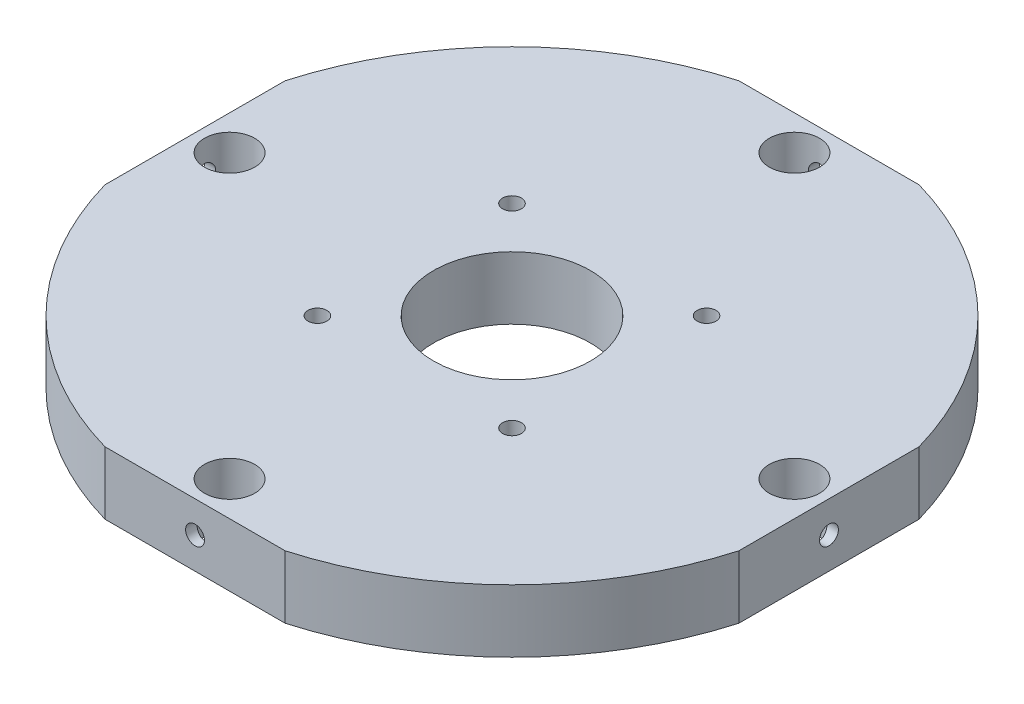
from build123d import *

# Parameters (mm, degrees)
SKETCH1_R               = 52.5
BOSS_EXTRUDE1_DEPTH     = 10
SKETCH3_R               = 4
CUT_EXTRUDE1_DEPTH      = 75.916620319
SKETCH4_W               = 28.705400188
SKETCH4_H               = 10
SKETCH4_W_2             = 10
SKETCH4_H_2             = 28.705400188
CUT_EXTRUDE_THIN1_DEPTH = 75.916620319
CUT_EXTRUDE3_REACH      = 115.363
SKETCH5_R               = 1.5
CIRPATTERN1_COUNT       = 4
SKETCH6_R               = 12.5
CUT_EXTRUDE4_DEPTH      = 73.114492456
SKETCH7_R               = 1.5
CUT_EXTRUDE5_DEPTH      = 73.114492456


with BuildPart() as part:
    # Sketch1 → Boss-Extrude1 (new body)
    with BuildSketch(Plane(origin=(0, 0, 0), x_dir=(1, 0, 0), z_dir=(0, 1, 0))):
        Circle(SKETCH1_R)
    extrude(amount=BOSS_EXTRUDE1_DEPTH)

    # Sketch3 → Cut-Extrude1 (cut, through all)
    with BuildSketch(Plane(origin=(0, 10, 0), x_dir=(1, 0, 0), z_dir=(0, 1, 0))):
        with Locations((0, 45)):
            Circle(SKETCH3_R)
        with Locations((45, 0)):
            Circle(SKETCH3_R)
        with Locations((0, -45)):
            Circle(SKETCH3_R)
        with Locations((-45, 0)):
            Circle(SKETCH3_R)
    extrude(amount=-CUT_EXTRUDE1_DEPTH, mode=Mode.SUBTRACT)

    # Sketch4 → Cut-Extrude-Thin1 (cut, through all)
    with BuildSketch(Plane(origin=(0, 10, 0), x_dir=(1, 0, 0), z_dir=(0, 1, 0))):
        with Locations((0, -55.5)):
            Rectangle(SKETCH4_W, SKETCH4_H)
        with Locations((55.5, 0)):
            Rectangle(SKETCH4_W_2, SKETCH4_H_2)
        with Locations((0, 55.5)):
            Rectangle(SKETCH4_W, SKETCH4_H)
        with Locations((-55.5, 0)):
            Rectangle(SKETCH4_W_2, SKETCH4_H_2)
    extrude(amount=-CUT_EXTRUDE_THIN1_DEPTH, mode=Mode.SUBTRACT)

    # Sketch5 → Cut-Extrude3 (cut, up to next)
    with BuildSketch(Plane.XY.offset(50.5), mode=Mode.PRIVATE) as cut_extrude3_sk1:
        with Locations((0, 5)):
            Circle(SKETCH5_R)
    cut_extrude3_tool1 = extrude(cut_extrude3_sk1.sketch, amount=-CUT_EXTRUDE3_REACH, mode=Mode.PRIVATE) & part.part
    cut_extrude3 = cut_extrude3_tool1.solids().sort_by_distance((0, 5, 50.5))[0]
    add(cut_extrude3, mode=Mode.SUBTRACT)

    # CirPattern1: Cut-Extrude3 ×4 about axis
    cirpattern1_axis = Axis((0, 10, 0), (0, -1, 0))
    for i in range(1, CIRPATTERN1_COUNT):
        add(cut_extrude3.rotate(cirpattern1_axis, i * 360 / CIRPATTERN1_COUNT), mode=Mode.SUBTRACT)

    # Sketch6 → Cut-Extrude4 (cut, through all)
    with BuildSketch(Plane(origin=(0, 10, 0), x_dir=(1, 0, 0), z_dir=(0, 1, 0))):
        Circle(SKETCH6_R)
    extrude(amount=-CUT_EXTRUDE4_DEPTH, mode=Mode.SUBTRACT)

    # Sketch7 → Cut-Extrude5 (cut, through all)
    with BuildSketch(Plane(origin=(0, 10, 0), x_dir=(1, 0, 0), z_dir=(0, 1, 0))):
        with Locations((-15.5, 15.5)):
            Circle(SKETCH7_R)
        with Locations((15.5, 15.5)):
            Circle(SKETCH7_R)
        with Locations((15.5, -15.5)):
            Circle(SKETCH7_R)
        with Locations((-15.5, -15.5)):
            Circle(SKETCH7_R)
    extrude(amount=-CUT_EXTRUDE5_DEPTH, mode=Mode.SUBTRACT)


solid = part.part
